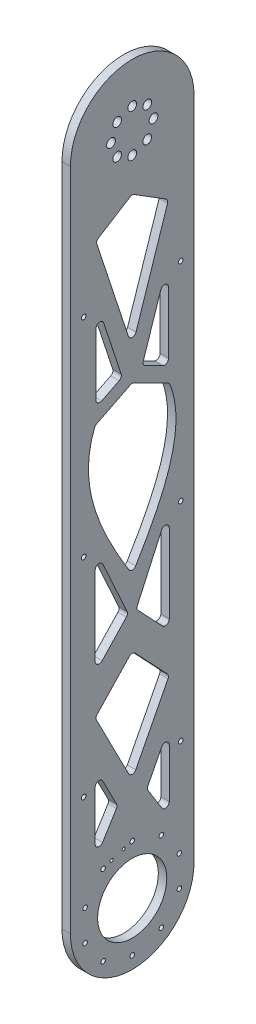
from build123d import *

# Parameters (mm, degrees)
SKETCH1_R           = 3.3
SKETCH1_R_2         = 1.7
SKETCH1_R_3         = 26
BOSS_EXTRUDE1_DEPTH = 6.35
CUT_EXTRUDE1_DEPTH  = 549.511460682
FILLET1_R           = 3
SKETCH4_R           = 1.75
CUT_EXTRUDE2_DEPTH  = 549.511460792
SKETCH5_R           = 1.2
CUT_EXTRUDE4_DEPTH  = 549.511460792


with BuildPart() as part:
    # Sketch1 → Boss-Extrude1 (new body)
    with BuildSketch(Plane(origin=(0, 0, 0), x_dir=(0, -1, 0), z_dir=(1, 0, 0))):
        with BuildLine():
            Line((500, 46.5), (0, 46.5))
            ThreePointArc((0, 46.5), (-46.5, 0), (0, -46.5))
            Line((0, -46.5), (500, -46.5))
            ThreePointArc((500, -46.5), (546.5, 0), (500, 46.5))
        make_face()
        with Locations((0, -16)):
            Circle(SKETCH1_R, mode=Mode.SUBTRACT)
        with Locations((-11.313708499, -11.313708499)):
            Circle(SKETCH1_R, mode=Mode.SUBTRACT)
        with Locations((11.313708499, -11.313708499)):
            Circle(SKETCH1_R, mode=Mode.SUBTRACT)
        with Locations((16, 0)):
            Circle(SKETCH1_R, mode=Mode.SUBTRACT)
        with Locations((488.48911696, -35.426855232)):
            Circle(SKETCH1_R_2, mode=Mode.SUBTRACT)
        with Locations((511.51088304, -35.426855232)):
            Circle(SKETCH1_R_2, mode=Mode.SUBTRACT)
        with Locations((469.86411696, -21.895000648)):
            Circle(SKETCH1_R_2, mode=Mode.SUBTRACT)
        with Locations((530.13588304, -21.895000648)):
            Circle(SKETCH1_R_2, mode=Mode.SUBTRACT)
        with Locations((462.75, 0)):
            Circle(SKETCH1_R_2, mode=Mode.SUBTRACT)
        with Locations((-16, 0)):
            Circle(SKETCH1_R, mode=Mode.SUBTRACT)
        with Locations((-11.313708499, 11.313708499)):
            Circle(SKETCH1_R, mode=Mode.SUBTRACT)
        with Locations((11.313708499, 11.313708499)):
            Circle(SKETCH1_R, mode=Mode.SUBTRACT)
        with Locations((0, 16)):
            Circle(SKETCH1_R, mode=Mode.SUBTRACT)
        with Locations((500, 0)):
            Circle(SKETCH1_R_3, mode=Mode.SUBTRACT)
        with Locations((537.25, 0)):
            Circle(SKETCH1_R_2, mode=Mode.SUBTRACT)
        with Locations((469.86411696, 21.895000648)):
            Circle(SKETCH1_R_2, mode=Mode.SUBTRACT)
        with Locations((530.13588304, 21.895000648)):
            Circle(SKETCH1_R_2, mode=Mode.SUBTRACT)
        with Locations((488.48911696, 35.426855232)):
            Circle(SKETCH1_R_2, mode=Mode.SUBTRACT)
        with Locations((511.51088304, 35.426855232)):
            Circle(SKETCH1_R_2, mode=Mode.SUBTRACT)
    extrude(amount=BOSS_EXTRUDE1_DEPTH)

    # Sketch3 → Cut-Extrude1 (cut, through all)
    with BuildSketch(Plane(origin=(6.35, 0, 0), x_dir=(0, 0, -1), z_dir=(1, 0, 0))):
        Polygon((0, -422.848022722), (27.858212922, -368.632839363), (0, -339.139268075), (-27.858212922, -368.632839363), align=None)
        Polygon((0, -41.368651369), (-27.312924288, -58.435222232), (0, -141.248998295), (27.312924288, -58.435222232), align=None)
        Polygon((3, -313.189087212), (27.858212922, -339.506549748), (27.858212922, -258.646044282), align=None)
        Polygon((-27.858212922, -339.506549748), (-27.858212922, -258.646044282), (-3, -313.189087212), align=None)
        Polygon((-27.858212922, -401.452857349), (-11, -434.260816252), (-27.858212922, -461.481824785), align=None)
        Polygon((11, -434.260816252), (27.858212922, -461.481824785), (27.858212922, -401.452857349), align=None)
        with BuildLine():
            Line((0, -164.248853344), (-27.858212922, -178.200474573))
            add(Edge.make_bspline(
                [(-27.858212922, -178.200474573), (-43.7790539, -216.093343216), (-18.61661693, -258.276071598), (0, -289.085024731)],
                knots=[0, 0, 0, 0, 1, 1, 1, 1], degree=3))
            add(Edge.make_bspline(
                [(27.858212922, -178.200474573), (43.7790539, -216.093343216), (18.61661693, -258.276071598), (0, -289.085024731)],
                knots=[0, 0, 0, 0, 1, 1, 1, 1], degree=3))
            Line((27.858212922, -178.200474573), (0, -164.248853344))
        make_face()
        Polygon((7.5, -156.820958214), (27.312924288, -96.747453897), (27.312924288, -166.743432993), align=None)
        Polygon((-27.312924288, -96.747453897), (-27.312924288, -166.743432993), (-7.5, -156.820958214), align=None)
    extrude(amount=-CUT_EXTRUDE1_DEPTH, mode=Mode.SUBTRACT)

    # Fillet1
    fillet1_edges = [part.edges().sort_by_distance(p)[0] for p in [
        (3.175, -58.435222232, -27.312924288),
        (3.175, -41.368651369, 0),
        (3.175, -58.435222232, 27.312924288),
        (3.175, -141.248998295, 0),
        (3.175, -289.085024731, 0),
        (3.175, -164.248853344, 0),
        (3.175, -401.452857349, 27.858212922),
        (3.175, -434.260816252, 11),
        (3.175, -461.481824785, 27.858212922),
        (3.175, -461.481824785, -27.858212922),
        (3.175, -434.260816252, -11),
        (3.175, -401.452857349, -27.858212922),
        (3.175, -368.632839363, -27.858212922),
        (3.175, -339.139268075, 0),
        (3.175, -368.632839363, 27.858212922),
        (3.175, -422.848022722, 0),
        (3.175, -313.189087212, 3),
        (3.175, -339.506549748, 27.858212922),
        (3.175, -258.646044282, 27.858212922),
        (3.175, -178.200474573, -27.858212922),
        (3.175, -178.200474573, 27.858212922),
        (3.175, -339.506549748, -27.858212922),
        (3.175, -313.189087212, -3),
        (3.175, -258.646044282, -27.858212922),
        (3.175, -96.747453897, 27.312924288),
        (3.175, -166.743432993, 27.312924288),
        (3.175, -156.820958214, 7.5),
        (3.175, -166.743432993, -27.312924288),
        (3.175, -156.820958214, -7.5),
        (3.175, -96.747453897, -27.312924288),
    ]]
    fillet(fillet1_edges, radius=FILLET1_R)

    # Sketch4 → Cut-Extrude2 (cut, through all)
    with BuildSketch(Plane(origin=(6.35, 0, 0), x_dir=(0, 0, -1), z_dir=(1, 0, 0))):
        with Locations((-36.5, -103.175)):
            Circle(SKETCH4_R)
        with Locations((36.5, -103.175)):
            Circle(SKETCH4_R)
        with Locations((-36.5, -259.525)):
            Circle(SKETCH4_R)
        with Locations((36.5, -259.525)):
            Circle(SKETCH4_R)
        with Locations((-36.5, -415.875)):
            Circle(SKETCH4_R)
        with Locations((36.5, -415.875)):
            Circle(SKETCH4_R)
    extrude(amount=-CUT_EXTRUDE2_DEPTH, mode=Mode.SUBTRACT)

    # Sketch5 → Cut-Extrude4 (cut, through all)
    with BuildSketch(Plane(origin=(6.35, 0, 0), x_dir=(0, 0, -1), z_dir=(1, 0, 0))):
        with Locations((-6.483486547, -464.674557297)):
            Circle(SKETCH5_R)
        with Locations((-15.518523452, -467.610218743)):
            Circle(SKETCH5_R)
    extrude(amount=-CUT_EXTRUDE4_DEPTH, mode=Mode.SUBTRACT)


solid = part.part
